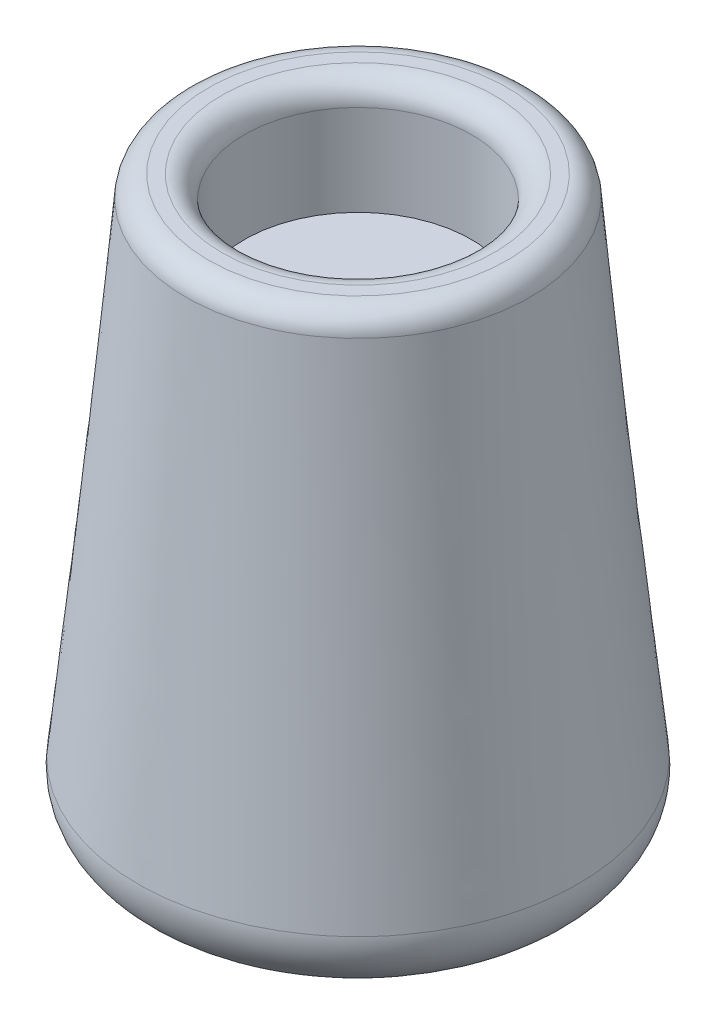
from build123d import *

# Parameters (mm, degrees)
CUT_EXTRUDE1_DEPTH      = 58.445626622
CUT_EXTRUDE1_DEPTH_BACK = 10
SKETCH3_R               = 10
FILLET4_R               = 5
FILLET5_R               = 2


with BuildPart() as part:
    # Loft1: read off the stored shape, not the designer's step
    # Loft1: loft between two sections, ruled curve by curve
    loft1_from = [
        Edge.make_bspline([(-10.493972108, 50, -10.718047835), (10.942123561, 50, -31.705992052), (31.930067778, 50, -10.269896382), (10.493972108, 50, 10.718047835), (-10.942123561, 50, 31.705992052), (-31.930067778, 50, 10.269896382), (-10.493972108, 50, -10.718047835)], [0, 0, 0, 0, 0.5, 0.5, 0.5, 1, 1, 1, 1], 3, [1, 0.333333333, 0.333333333, 1, 0.333333333, 0.333333333, 1]),
    ]
    loft1_to = [
        Edge.make_bspline([(-17.436793853, 0, -9.795826669), (2.154859485, 0, -44.669414375), (37.028447191, 0, -25.077761037), (17.436793853, 0, 9.795826669), (-2.154859485, 0, 44.669414375), (-37.028447191, 0, 25.077761037), (-17.436793853, 0, -9.795826669)], [0, 0, 0, 0, 0.5, 0.5, 0.5, 1, 1, 1, 1], 3, [1, 0.333333333, 0.333333333, 1, 0.333333333, 0.333333333, 1]),
    ]
    loft1 = Solid(Shell([*[Face.make_surface_from_curves(loft1_from[k], loft1_to[k]) for k in range(1)], Face(Wire(loft1_from)), Face(Wire(loft1_to))]))
    add(loft1)

    # Sketch3 → Cut-Extrude1 (cut, two sides: drawn at the far end of the back side and taken through both)
    with BuildSketch(Plane(origin=(0, 50, 0), x_dir=(1, 0, 0), z_dir=(0, 1, 0)).offset(-CUT_EXTRUDE1_DEPTH_BACK)):
        with Locations(Location((0, 0, 0), (0, 0, 270))):
            Circle(SKETCH3_R)
    extrude(amount=CUT_EXTRUDE1_DEPTH + CUT_EXTRUDE1_DEPTH_BACK, mode=Mode.SUBTRACT)

    # Fillet4
    fillet4_edges = [part.edges().sort_by_distance(p)[0] for p in [
        (17.436793853, 0, 9.795826669),
    ]]
    fillet(fillet4_edges, radius=FILLET4_R)

    # Fillet5
    fillet5_edges = [part.edges().sort_by_distance(p)[0] for p in [
        (10.493972108, 50, 10.718047835),
        (0, 50, -10),
    ]]
    fillet(fillet5_edges, radius=FILLET5_R)


solid = part.part
